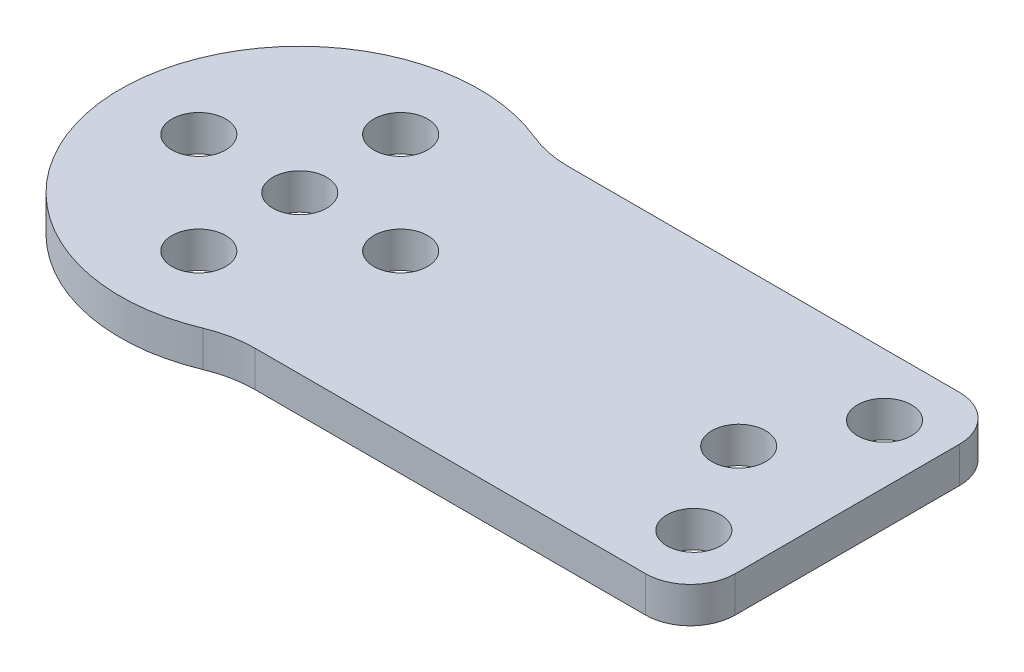
from build123d import *

# Parameters (mm, degrees)
BOSS_EXTRUDE1_DEPTH = 0.8
FILLET1_R           = 2
FILLET2_R           = 5
SKETCH2_R           = 1.2
CUT_EXTRUDE1_DEPTH  = 23.249719099
SKETCH3_R           = 1.2
CUT_EXTRUDE2_DEPTH  = 23.249719099


with BuildPart() as part:
    # Sketch1 → Boss-Extrude1 (new, symmetric)
    with BuildSketch(Plane(origin=(0, 0, 0), x_dir=(1, 0, 0), z_dir=(0, 1, 0))):
        with BuildLine():
            Line((11.716387939, 7), (-8.827016654, 7))
            ThreePointArc((-8.827016654, 7), (-20.7, 0), (-8.827016654, -7))
            Line((-8.827016654, -7), (11.716387939, -7))
            Line((11.716387939, -7), (11.716387939, 7))
        make_face()
    extrude(amount=BOSS_EXTRUDE1_DEPTH, both=True)

    # Fillet1
    fillet1_edges = [part.edges().sort_by_distance(p)[0] for p in [
        (11.716387939, 0, -7),
        (11.716387939, 0, 7),
    ]]
    fillet(fillet1_edges, radius=FILLET1_R)

    # Fillet2
    fillet2_edges = [part.edges().sort_by_distance(p)[0] for p in [
        (-8.827016654, 0, -7),
        (-8.827016654, 0, 7),
    ]]
    fillet(fillet2_edges, radius=FILLET2_R)

    # Sketch2 → Cut-Extrude1 (cut, through all)
    with BuildSketch(Plane(origin=(0, 0.8, 0), x_dir=(1, 0, 0), z_dir=(0, 1, 0))):
        with Locations((-8.2, 0)):
            Circle(SKETCH2_R)
        with Locations((-12.7, 4.5)):
            Circle(SKETCH2_R)
        with Locations((-17.2, 0)):
            Circle(SKETCH2_R)
        with Locations((-12.7, -4.5)):
            Circle(SKETCH2_R)
        with Locations((-12.7, 0)):
            Circle(SKETCH2_R)
    extrude(amount=-CUT_EXTRUDE1_DEPTH, mode=Mode.SUBTRACT)

    # Sketch3 → Cut-Extrude2 (cut, through all)
    with BuildSketch(Plane(origin=(0, 0.8, 0), x_dir=(1, 0, 0), z_dir=(0, 1, 0))):
        with Locations((9.121387939, 4.25)):
            Circle(SKETCH3_R)
        with Locations((9.121387939, -4.25)):
            Circle(SKETCH3_R)
        with Locations((6.871387939, 0)):
            Circle(SKETCH3_R)
    extrude(amount=-CUT_EXTRUDE2_DEPTH, mode=Mode.SUBTRACT)


solid = part.part
